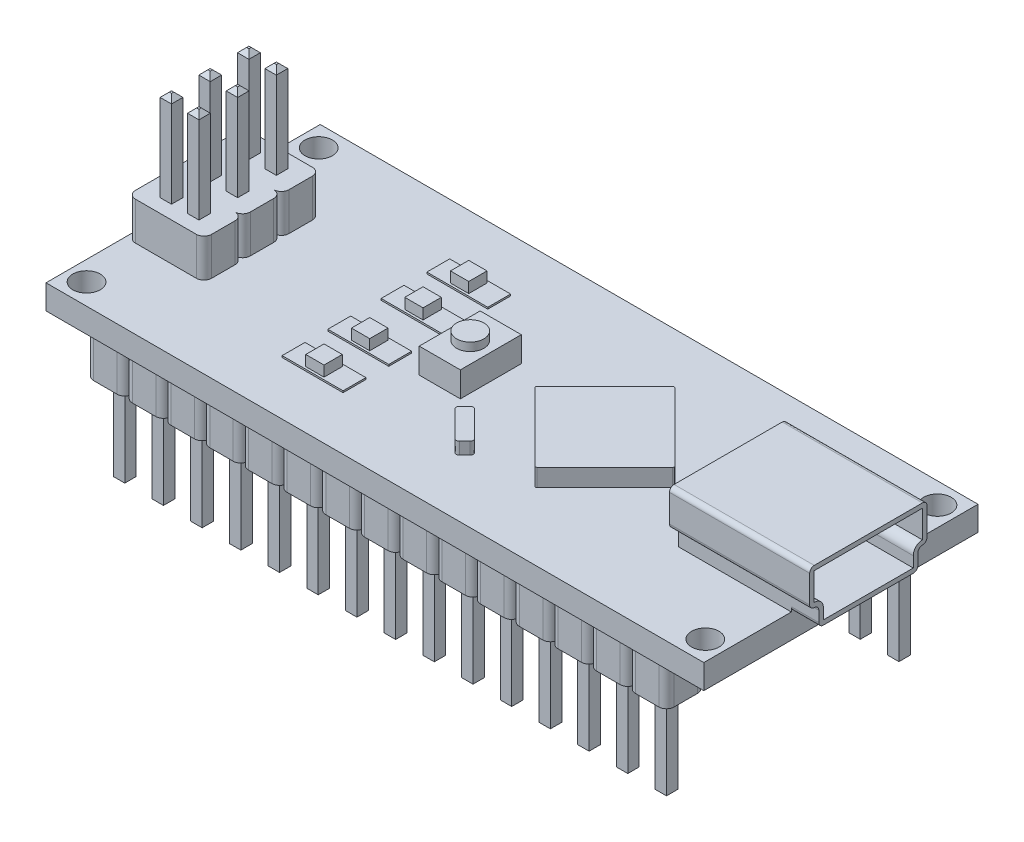
from build123d import *

# Parameters (mm, degrees)
SKETCH1_W                  = 43.18
SKETCH1_H                  = 18
BOSS_EXTRUDE1_DEPTH        = 1.6
SKETCH2_R                  = 0.9
CUT_EXTRUDE1_DEPTH         = 24.445428126
SKETCH3_W                  = 5
SKETCH3_H                  = 2.54
BOSS_EXTRUDE2_DEPTH        = 2.5
FILLET1_R                  = 0.5
SKETCH4_W                  = 0.75
SKETCH4_H                  = 0.75
BOSS_EXTRUDE3_DEPTH        = 6
CHAMFER1_SIZE              = 0.3
MIRROR1_START              = 1.6
MIRROR1_DEPTH              = 2.5
MIRROR1_START_2            = 4.1
MIRROR1_2_OUTLINE_W        = 0.75
MIRROR1_2_OUTLINE_H        = 0.75
MIRROR1_2_DEPTH            = 5.7
MIRROR2_START              = 1.6
MIRROR2_DEPTH              = 2.5
MIRROR2_START_2            = 4.1
MIRROR2_2_OUTLINE_W        = 0.75
MIRROR2_2_OUTLINE_H        = 0.75
MIRROR2_2_DEPTH            = 5.7
SKETCH5_W                  = 4
SKETCH5_H                  = 1.5
SKETCH5_W_2                = 1.2
SKETCH5_H_2                = 1.2
BOSS_EXTRUDE4_DEPTH        = 0.11
SKETCH5_4_W                = 1.2
SKETCH5_4_H                = 1.2
BOSS_EXTRUDE6_DEPTH        = 0.8
SKETCH8_W                  = 2.7
SKETCH8_H                  = 4
BOSS_EXTRUDE7_DEPTH        = 1.65
SKETCH9_R                  = 0.9
BOSS_EXTRUDE8_DEPTH        = 0.54
BOSS_EXTRUDE9_DEPTH        = 1.8
BOSS_EXTRUDE9_DEPTH_BACK   = 7.4
SKETCH10_W                 = 6.5
SKETCH10_H                 = 1.3
FILLET3_R                  = 0.3
CUT_EXTRUDE2_DEPTH         = 5.5
BOSS_EXTRUDE10_DEPTH       = 1.15
FILLET4_R                  = 0.1
BOSS_EXTRUDE11_DEPTH       = 0.8
FILLET5_R                  = 0.2
SKETCH14_W                 = 2.54
SKETCH14_H                 = 2.54
BOSS_EXTRUDE12_DEPTH       = 2.5
FILLET6_R                  = 0.5
LPATTERN1_START            = -2.5
LPATTERN1_DEPTH            = 2.5
SKETCH15_W                 = 2.54
SKETCH15_H                 = 2.54
BOSS_EXTRUDE13_DEPTH       = 2.5
FILLET7_R                  = 0.5
LPATTERN2_START            = -2.5
LPATTERN2_DEPTH            = 2.5
SKETCH16_W                 = 0.75
SKETCH16_H                 = 0.75
BOSS_EXTRUDE14_DEPTH       = 6
CHAMFER2_SIZE              = 0.3
LPATTERN4_COUNT            = 15
LPATTERN4_PITCH            = 2.54
CHAMFER2_OF_LPATTERN4_SIZE = 0.3
MIRROR6_START              = 7.255
MIRROR6_DEPTH              = 0.75
MIRROR6_START_2            = -11.458665389
MIRROR6_2_OUTLINE_W        = 40
MIRROR6_2_OUTLINE_H        = 1.331784092
MIRROR6_2_DEPTH            = 1.458665389
MIRROR6_START_3            = -11.670797423
MIRROR6_3_OUTLINE_W        = 40
MIRROR6_3_OUTLINE_H        = 1.668215908
MIRROR6_3_DEPTH            = 0.212132034


with BuildPart() as part:
    # Sketch1 → Boss-Extrude1 (new body)
    with BuildSketch(Plane(origin=(0, 0, 0), x_dir=(1, 0, 0), z_dir=(0, 1, 0))):
        Rectangle(SKETCH1_W, SKETCH1_H)
    extrude(amount=BOSS_EXTRUDE1_DEPTH)

    # Sketch2 → Cut-Extrude1 (cut, through all)
    with BuildSketch(Plane(origin=(0, 1.6, 0), x_dir=(1, 0, 0), z_dir=(0, 1, 0))):
        with Locations(Location((20.31, 7.62, 0), (0, 0, 270))):
            Circle(SKETCH2_R)
        with Locations(Location((20.31, -7.62, 0), (0, 0, 270))):
            Circle(SKETCH2_R)
        with Locations(Location((-20.31, -7.62, 0), (0, 0, 270))):
            Circle(SKETCH2_R)
        with Locations(Location((-20.31, 7.62, 0), (0, 0, 270))):
            Circle(SKETCH2_R)
    extrude(amount=-CUT_EXTRUDE1_DEPTH, mode=Mode.SUBTRACT)

    # Sketch3 → Boss-Extrude2 (add)
    with BuildSketch(Plane(origin=(0, 1.6, 0), x_dir=(1, 0, 0), z_dir=(0, 1, 0))):
        with Locations((-18.91, 0)):
            Rectangle(SKETCH3_W, SKETCH3_H)
    extrude(amount=BOSS_EXTRUDE2_DEPTH)

    # Fillet1
    fillet1_edges = [part.edges().sort_by_distance(p)[0] for p in [
        (-21.41, 2.85, -1.27),
        (-21.41, 2.85, 1.27),
        (-16.41, 2.85, 1.27),
        (-16.41, 2.85, -1.27),
    ]]
    fillet(fillet1_edges, radius=FILLET1_R)

    # Sketch4 → Boss-Extrude3 (add)
    with BuildSketch(Plane(origin=(0, 4.1, 0), x_dir=(1, 0, 0), z_dir=(0, 1, 0))):
        with Locations((-18.01, 0)):
            Rectangle(SKETCH4_W, SKETCH4_H)
        with Locations((-19.81, 0)):
            Rectangle(SKETCH4_W, SKETCH4_H)
    extrude(amount=BOSS_EXTRUDE3_DEPTH)

    # Chamfer1
    chamfer1_edges = [part.edges().sort_by_distance(p)[0] for p in [
        (-17.635, 10.1, 0),
        (-18.01, 10.1, -0.375),
        (-18.385, 10.1, 0),
        (-18.01, 10.1, 0.375),
        (-20.185, 10.1, 0),
        (-19.81, 10.1, 0.375),
        (-19.435, 10.1, 0),
        (-19.81, 10.1, -0.375),
    ]]
    chamfer(chamfer1_edges, length=CHAMFER1_SIZE)

    # Mirror1: read off the stored shape, not the designer's step
    # Mirror1 outline → Mirror1 (add)
    with BuildSketch(Plane(origin=(0, 0, 0), x_dir=(1, 0, 0), z_dir=(0, 1, 0)).offset(MIRROR1_START)):
        with BuildLine():
            ThreePointArc((-20.91, 3.81), (-21.263553391, 3.663553391), (-21.41, 3.31))
            Line((-21.41, 3.31), (-21.41, 1.77))
            ThreePointArc((-21.41, 1.77), (-21.263553391, 1.416446609), (-20.91, 1.27))
            Line((-20.91, 1.27), (-16.91, 1.27))
            ThreePointArc((-16.91, 1.27), (-16.556446609, 1.416446609), (-16.41, 1.77))
            Line((-16.41, 1.77), (-16.41, 3.31))
            ThreePointArc((-16.41, 3.31), (-16.556446609, 3.663553391), (-16.91, 3.81))
            Line((-16.91, 3.81), (-20.91, 3.81))
        make_face()
    extrude(amount=MIRROR1_DEPTH)

    # Mirror1 2 outline → Mirror1 2 (add)
    with BuildSketch(Plane(origin=(0, 0, 0), x_dir=(1, 0, 0), z_dir=(0, 1, 0)).offset(MIRROR1_START_2)):
        with Locations((-18.01, 2.54)):
            Rectangle(MIRROR1_2_OUTLINE_W, MIRROR1_2_OUTLINE_H)
        with Locations((-19.81, 2.54)):
            Rectangle(MIRROR1_2_OUTLINE_W, MIRROR1_2_OUTLINE_H)
    extrude(amount=MIRROR1_2_DEPTH)

    # Mirror1 3: loft between two sections, ruled curve by curve
    mirror1_3_from = [
        Edge.make_line((-17.635, 9.8, -2.915), (-17.635, 9.8, -2.165)),
        Edge.make_line((-18.385, 9.8, -2.165), (-18.385, 9.8, -2.915)),
        Edge.make_line((-17.635, 9.8, -2.165), (-18.385, 9.8, -2.165)),
        Edge.make_line((-17.635, 9.8, -2.915), (-18.385, 9.8, -2.915)),
    ]
    mirror1_3_to = [
        Edge.make_line((-17.935, 10.1, -2.615), (-17.935, 10.1, -2.465)),
        Edge.make_line((-18.085, 10.1, -2.465), (-18.085, 10.1, -2.615)),
        Edge.make_line((-17.935, 10.1, -2.465), (-18.085, 10.1, -2.465)),
        Edge.make_line((-17.935, 10.1, -2.615), (-18.085, 10.1, -2.615)),
    ]
    mirror1_3 = Solid(Shell([*[Face.make_surface_from_curves(mirror1_3_from[k], mirror1_3_to[k]) for k in range(4)], Face(Wire(mirror1_3_from)), Face(Wire(mirror1_3_to))]))
    add(mirror1_3)

    # Mirror1 4: loft between two sections, ruled curve by curve
    mirror1_4_from = [
        Edge.make_line((-19.435, 9.8, -2.915), (-19.435, 9.8, -2.165)),
        Edge.make_line((-20.185, 9.8, -2.165), (-20.185, 9.8, -2.915)),
        Edge.make_line((-19.435, 9.8, -2.165), (-20.185, 9.8, -2.165)),
        Edge.make_line((-19.435, 9.8, -2.915), (-20.185, 9.8, -2.915)),
    ]
    mirror1_4_to = [
        Edge.make_line((-19.735, 10.1, -2.615), (-19.735, 10.1, -2.465)),
        Edge.make_line((-19.885, 10.1, -2.465), (-19.885, 10.1, -2.615)),
        Edge.make_line((-19.735, 10.1, -2.465), (-19.885, 10.1, -2.465)),
        Edge.make_line((-19.735, 10.1, -2.615), (-19.885, 10.1, -2.615)),
    ]
    mirror1_4 = Solid(Shell([*[Face.make_surface_from_curves(mirror1_4_from[k], mirror1_4_to[k]) for k in range(4)], Face(Wire(mirror1_4_from)), Face(Wire(mirror1_4_to))]))
    add(mirror1_4)

    # Mirror2: read off the stored shape, not the designer's step
    # Mirror2 outline → Mirror2 (add)
    with BuildSketch(Plane(origin=(0, 0, 0), x_dir=(1, 0, 0), z_dir=(0, 1, 0)).offset(MIRROR2_START)):
        with BuildLine():
            ThreePointArc((-20.91, -1.27), (-21.263553391, -1.416446609), (-21.41, -1.77))
            Line((-21.41, -1.77), (-21.41, -3.31))
            ThreePointArc((-21.41, -3.31), (-21.263553391, -3.663553391), (-20.91, -3.81))
            Line((-20.91, -3.81), (-16.91, -3.81))
            ThreePointArc((-16.91, -3.81), (-16.556446609, -3.663553391), (-16.41, -3.31))
            Line((-16.41, -3.31), (-16.41, -1.77))
            ThreePointArc((-16.41, -1.77), (-16.556446609, -1.416446609), (-16.91, -1.27))
            Line((-16.91, -1.27), (-20.91, -1.27))
        make_face()
    extrude(amount=MIRROR2_DEPTH)

    # Mirror2 2 outline → Mirror2 2 (add)
    with BuildSketch(Plane(origin=(0, 0, 0), x_dir=(1, 0, 0), z_dir=(0, 1, 0)).offset(MIRROR2_START_2)):
        with Locations((-18.01, -2.54)):
            Rectangle(MIRROR2_2_OUTLINE_W, MIRROR2_2_OUTLINE_H)
        with Locations((-19.81, -2.54)):
            Rectangle(MIRROR2_2_OUTLINE_W, MIRROR2_2_OUTLINE_H)
    extrude(amount=MIRROR2_2_DEPTH)

    # Mirror2 3: loft between two sections, ruled curve by curve
    mirror2_3_from = [
        Edge.make_line((-17.635, 9.8, 2.165), (-17.635, 9.8, 2.915)),
        Edge.make_line((-18.385, 9.8, 2.915), (-18.385, 9.8, 2.165)),
        Edge.make_line((-17.635, 9.8, 2.915), (-18.385, 9.8, 2.915)),
        Edge.make_line((-17.635, 9.8, 2.165), (-18.385, 9.8, 2.165)),
    ]
    mirror2_3_to = [
        Edge.make_line((-17.935, 10.1, 2.465), (-17.935, 10.1, 2.615)),
        Edge.make_line((-18.085, 10.1, 2.615), (-18.085, 10.1, 2.465)),
        Edge.make_line((-17.935, 10.1, 2.615), (-18.085, 10.1, 2.615)),
        Edge.make_line((-17.935, 10.1, 2.465), (-18.085, 10.1, 2.465)),
    ]
    mirror2_3 = Solid(Shell([*[Face.make_surface_from_curves(mirror2_3_from[k], mirror2_3_to[k]) for k in range(4)], Face(Wire(mirror2_3_from)), Face(Wire(mirror2_3_to))]))
    add(mirror2_3)

    # Mirror2 4: loft between two sections, ruled curve by curve
    mirror2_4_from = [
        Edge.make_line((-19.435, 9.8, 2.165), (-19.435, 9.8, 2.915)),
        Edge.make_line((-20.185, 9.8, 2.915), (-20.185, 9.8, 2.165)),
        Edge.make_line((-19.435, 9.8, 2.915), (-20.185, 9.8, 2.915)),
        Edge.make_line((-19.435, 9.8, 2.165), (-20.185, 9.8, 2.165)),
    ]
    mirror2_4_to = [
        Edge.make_line((-19.735, 10.1, 2.465), (-19.735, 10.1, 2.615)),
        Edge.make_line((-19.885, 10.1, 2.615), (-19.885, 10.1, 2.465)),
        Edge.make_line((-19.735, 10.1, 2.615), (-19.885, 10.1, 2.615)),
        Edge.make_line((-19.735, 10.1, 2.465), (-19.885, 10.1, 2.465)),
    ]
    mirror2_4 = Solid(Shell([*[Face.make_surface_from_curves(mirror2_4_from[k], mirror2_4_to[k]) for k in range(4)], Face(Wire(mirror2_4_from)), Face(Wire(mirror2_4_to))]))
    add(mirror2_4)

    # Sketch5 → Boss-Extrude4 (add)
    # profile 1 of 2: a face of its own
    with BuildSketch(Plane(origin=(0, 1.6, 0), x_dir=(1, 0, 0), z_dir=(0, 1, 0))):
        with Locations((-7.59, 4.75)):
            Rectangle(SKETCH5_W, SKETCH5_H)
        with Locations((-7.59, 4.75)):
            Rectangle(SKETCH5_W_2, SKETCH5_H_2, mode=Mode.SUBTRACT)
    # profile 2 of 2: a face of its own
    with BuildSketch(Plane(origin=(0, 1.6, 0), x_dir=(1, 0, 0), z_dir=(0, 1, 0))):
        with Locations((-7.59, 1.75)):
            Rectangle(SKETCH5_W, SKETCH5_H)
        with Locations((-7.59, 1.75)):
            Rectangle(SKETCH5_W_2, SKETCH5_H_2, mode=Mode.SUBTRACT)
    boss_extrude4 = extrude(amount=BOSS_EXTRUDE4_DEPTH)

    # Sketch5<4> → Boss-Extrude6 (add)
    with BuildSketch(Plane(origin=(0, 1.6, 0), x_dir=(1, 0, 0), z_dir=(0, 1, 0))):
        with Locations((-7.59, 4.75)):
            Rectangle(SKETCH5_4_W, SKETCH5_4_H)
        with Locations((-7.59, 1.75)):
            Rectangle(SKETCH5_4_W, SKETCH5_4_H)
    boss_extrude6 = extrude(amount=BOSS_EXTRUDE6_DEPTH)

    # Mirror3: Boss-Extrude4, Boss-Extrude6 across plane
    add(boss_extrude4.mirror(Plane.XY))
    add(boss_extrude6.mirror(Plane.XY))

    # Sketch8 → Boss-Extrude7 (add)
    with BuildSketch(Plane(origin=(0, 1.6, 0), x_dir=(1, 0, 0), z_dir=(0, 1, 0))):
        with Locations((-2.74, 0)):
            Rectangle(SKETCH8_W, SKETCH8_H)
    extrude(amount=BOSS_EXTRUDE7_DEPTH)

    # Sketch9 → Boss-Extrude8 (add)
    with BuildSketch(Plane(origin=(0, 3.25, 0), x_dir=(1, 0, 0), z_dir=(0, 1, 0))):
        with Locations(Location((-2.74, 0, 0), (0, 0, 270))):
            Circle(SKETCH9_R)
    extrude(amount=BOSS_EXTRUDE8_DEPTH)

    # Sketch10 → Boss-Extrude9 (add, two sides: drawn at the far end of the back side and taken through both)
    with BuildSketch(Plane(origin=(21.59, 0, 0), x_dir=(0, 0, -1), z_dir=(1, 0, 0)).offset(-BOSS_EXTRUDE9_DEPTH_BACK)):
        Polygon((-3.85, 2.9), (-3.25, 2.9), (3.25, 2.9), (3.85, 2.9), (3.85, 5.3), (-3.85, 5.3), align=None)
        with Locations((0, 2.25)):
            Rectangle(SKETCH10_W, SKETCH10_H)
    extrude(amount=BOSS_EXTRUDE9_DEPTH + BOSS_EXTRUDE9_DEPTH_BACK)

    # Fillet3
    fillet3_edges = [part.edges().sort_by_distance(p)[0] for p in [
        (18.79, 2.9, 3.25),
        (18.79, 2.9, 3.85),
        (18.79, 2.9, -3.85),
        (18.79, 2.9, -3.25),
        (22.49, 1.6, 3.25),
        (22.49, 1.6, -3.25),
        (18.79, 5.3, -3.85),
        (18.79, 5.3, 3.85),
    ]]
    fillet(fillet3_edges, radius=FILLET3_R - 0.0001)  # a hair under: the kernel refuses the full size

    # Sketch11 → Cut-Extrude2 (cut)
    with BuildSketch(Plane(origin=(23.39, 0, 0), x_dir=(0, 0, -1), z_dir=(1, 0, 0))):
        with BuildLine():
            ThreePointArc((3.55, 3.2), (3.125735931, 3.024264069), (2.95, 2.6))
            Line((2.95, 2.6), (2.95, 1.9))
            Line((2.95, 1.9), (-2.95, 1.9))
            Line((-2.95, 1.9), (-2.95, 2.6))
            ThreePointArc((-2.95, 2.6), (-3.125735931, 3.024264069), (-3.55, 3.2))
            Line((-3.55, 3.2), (-3.55, 5))
            Line((-3.55, 5), (3.55, 5))
            Line((3.55, 5), (3.55, 3.2))
        make_face()
    extrude(amount=-CUT_EXTRUDE2_DEPTH, mode=Mode.SUBTRACT)

    # Sketch12 → Boss-Extrude10 (add)
    with BuildSketch(Plane(origin=(0, 1.6, 0), x_dir=(1, 0, 0), z_dir=(0, 1, 0))):
        Polygon((1.497611845, 0), (6.093805922, 4.596194078), (10.69, 0), (6.093805922, -4.596194078), align=None)
    extrude(amount=BOSS_EXTRUDE10_DEPTH)

    # Fillet4
    fillet4_edges = [part.edges().sort_by_distance(p)[0] for p in [
        (1.497611845, 2.175, 0),
        (6.093805922, 2.175, 4.596194078),
        (10.69, 2.175, 0),
        (6.093805922, 2.175, -4.596194078),
    ]]
    fillet(fillet4_edges, radius=FILLET4_R)

    # Sketch13 → Boss-Extrude11 (add)
    with BuildSketch(Plane(origin=(0, 1.6, 0), x_dir=(1, 0, 0), z_dir=(0, 1, 0))):
        Polygon((2.275429304, -4.737615434), (0.295530317, -2.757716447), (-0.340865787, -3.39411255), (1.639033201, -5.374011537), align=None)
    extrude(amount=BOSS_EXTRUDE11_DEPTH)

    # Fillet5
    fillet5_edges = [part.edges().sort_by_distance(p)[0] for p in [
        (1.639033201, 2, 5.374011537),
        (2.275429304, 2, 4.737615434),
        (0.295530317, 2, 2.757716447),
        (-0.340865787, 2, 3.39411255),
    ]]
    fillet(fillet5_edges, radius=FILLET5_R)

    # Sketch14 → Boss-Extrude12 (add)
    with BuildSketch(Plane.XZ):
        with Locations((17.77, -7.63)):
            Rectangle(SKETCH14_W, SKETCH14_H)
    extrude(amount=BOSS_EXTRUDE12_DEPTH)

    # Fillet6
    fillet6_edges = [part.edges().sort_by_distance(p)[0] for p in [
        (19.04, -1.25, -8.9),
        (19.04, -1.25, -6.36),
        (16.5, -1.25, -6.36),
        (16.5, -1.25, -8.9),
    ]]
    fillet(fillet6_edges, radius=FILLET6_R)

    # LPattern1: read off the stored shape, not the designer's step
    # LPattern1 outline → LPattern1 (add)
    with BuildSketch(Plane(origin=(0, 0, 0), x_dir=(1, 0, 0), z_dir=(0, 1, 0)).offset(LPATTERN1_START)):
        with BuildLine():
            Line((14.46, 6.36), (16, 6.36))
            ThreePointArc((16, 6.36), (16.353553391, 6.506446609), (16.5, 6.86))
            Line((16.5, 6.86), (16.5, 8.4))
            ThreePointArc((16.5, 8.4), (16.353553391, 8.753553391), (16, 8.9))
            Line((16, 8.9), (14.46, 8.9))
            ThreePointArc((14.46, 8.9), (14.106446609, 8.753553391), (13.96, 8.4))
            ThreePointArc((13.96, 8.4), (13.813553391, 8.753553391), (13.46, 8.9))
            Line((13.46, 8.9), (11.92, 8.9))
            ThreePointArc((11.92, 8.9), (11.566446609, 8.753553391), (11.42, 8.4))
            ThreePointArc((11.42, 8.4), (11.273553391, 8.753553391), (10.92, 8.9))
            Line((10.92, 8.9), (9.38, 8.9))
            ThreePointArc((9.38, 8.9), (9.026446609, 8.753553391), (8.88, 8.4))
            ThreePointArc((8.88, 8.4), (8.733553391, 8.753553391), (8.38, 8.9))
            Line((8.38, 8.9), (6.84, 8.9))
            ThreePointArc((6.84, 8.9), (6.486446609, 8.753553391), (6.34, 8.4))
            ThreePointArc((6.34, 8.4), (6.193553391, 8.753553391), (5.84, 8.9))
            Line((5.84, 8.9), (4.3, 8.9))
            ThreePointArc((4.3, 8.9), (3.946446609, 8.753553391), (3.8, 8.4))
            ThreePointArc((3.8, 8.4), (3.653553391, 8.753553391), (3.3, 8.9))
            Line((3.3, 8.9), (1.76, 8.9))
            ThreePointArc((1.76, 8.9), (1.406446609, 8.753553391), (1.26, 8.4))
            ThreePointArc((1.26, 8.4), (1.113553391, 8.753553391), (0.76, 8.9))
            Line((0.76, 8.9), (-0.78, 8.9))
            ThreePointArc((-0.78, 8.9), (-1.133553391, 8.753553391), (-1.28, 8.4))
            ThreePointArc((-1.28, 8.4), (-1.426446609, 8.753553391), (-1.78, 8.9))
            Line((-1.78, 8.9), (-3.32, 8.9))
            ThreePointArc((-3.32, 8.9), (-3.673553391, 8.753553391), (-3.82, 8.4))
            ThreePointArc((-3.82, 8.4), (-3.966446609, 8.753553391), (-4.32, 8.9))
            Line((-4.32, 8.9), (-5.86, 8.9))
            ThreePointArc((-5.86, 8.9), (-6.213553391, 8.753553391), (-6.36, 8.4))
            ThreePointArc((-6.36, 8.4), (-6.506446609, 8.753553391), (-6.86, 8.9))
            Line((-6.86, 8.9), (-8.4, 8.9))
            ThreePointArc((-8.4, 8.9), (-8.753553391, 8.753553391), (-8.9, 8.4))
            ThreePointArc((-8.9, 8.4), (-9.046446609, 8.753553391), (-9.4, 8.9))
            Line((-9.4, 8.9), (-10.94, 8.9))
            ThreePointArc((-10.94, 8.9), (-11.293553391, 8.753553391), (-11.44, 8.4))
            ThreePointArc((-11.44, 8.4), (-11.586446609, 8.753553391), (-11.94, 8.9))
            Line((-11.94, 8.9), (-13.48, 8.9))
            ThreePointArc((-13.48, 8.9), (-13.833553391, 8.753553391), (-13.98, 8.4))
            ThreePointArc((-13.98, 8.4), (-14.126446609, 8.753553391), (-14.48, 8.9))
            Line((-14.48, 8.9), (-16.02, 8.9))
            ThreePointArc((-16.02, 8.9), (-16.373553391, 8.753553391), (-16.52, 8.4))
            ThreePointArc((-16.52, 8.4), (-16.666446609, 8.753553391), (-17.02, 8.9))
            Line((-17.02, 8.9), (-18.56, 8.9))
            ThreePointArc((-18.56, 8.9), (-18.913553391, 8.753553391), (-19.06, 8.4))
            Line((-19.06, 8.4), (-19.06, 6.86))
            ThreePointArc((-19.06, 6.86), (-18.913553391, 6.506446609), (-18.56, 6.36))
            Line((-18.56, 6.36), (-17.02, 6.36))
            ThreePointArc((-17.02, 6.36), (-16.666446609, 6.506446609), (-16.52, 6.86))
            ThreePointArc((-16.52, 6.86), (-16.373553391, 6.506446609), (-16.02, 6.36))
            Line((-16.02, 6.36), (-14.48, 6.36))
            ThreePointArc((-14.48, 6.36), (-14.126446609, 6.506446609), (-13.98, 6.86))
            ThreePointArc((-13.98, 6.86), (-13.833553391, 6.506446609), (-13.48, 6.36))
            Line((-13.48, 6.36), (-11.94, 6.36))
            ThreePointArc((-11.94, 6.36), (-11.586446609, 6.506446609), (-11.44, 6.86))
            ThreePointArc((-11.44, 6.86), (-11.293553391, 6.506446609), (-10.94, 6.36))
            Line((-10.94, 6.36), (-9.4, 6.36))
            ThreePointArc((-9.4, 6.36), (-9.046446609, 6.506446609), (-8.9, 6.86))
            ThreePointArc((-8.9, 6.86), (-8.753553391, 6.506446609), (-8.4, 6.36))
            Line((-8.4, 6.36), (-6.86, 6.36))
            ThreePointArc((-6.86, 6.36), (-6.506446609, 6.506446609), (-6.36, 6.86))
            ThreePointArc((-6.36, 6.86), (-6.213553391, 6.506446609), (-5.86, 6.36))
            Line((-5.86, 6.36), (-4.32, 6.36))
            ThreePointArc((-4.32, 6.36), (-3.966446609, 6.506446609), (-3.82, 6.86))
            ThreePointArc((-3.82, 6.86), (-3.673553391, 6.506446609), (-3.32, 6.36))
            Line((-3.32, 6.36), (-1.78, 6.36))
            ThreePointArc((-1.78, 6.36), (-1.426446609, 6.506446609), (-1.28, 6.86))
            ThreePointArc((-1.28, 6.86), (-1.133553391, 6.506446609), (-0.78, 6.36))
            Line((-0.78, 6.36), (0.76, 6.36))
            ThreePointArc((0.76, 6.36), (1.113553391, 6.506446609), (1.26, 6.86))
            ThreePointArc((1.26, 6.86), (1.406446609, 6.506446609), (1.76, 6.36))
            Line((1.76, 6.36), (3.3, 6.36))
            ThreePointArc((3.3, 6.36), (3.653553391, 6.506446609), (3.8, 6.86))
            ThreePointArc((3.8, 6.86), (3.946446609, 6.506446609), (4.3, 6.36))
            Line((4.3, 6.36), (5.84, 6.36))
            ThreePointArc((5.84, 6.36), (6.193553391, 6.506446609), (6.34, 6.86))
            ThreePointArc((6.34, 6.86), (6.486446609, 6.506446609), (6.84, 6.36))
            Line((6.84, 6.36), (8.38, 6.36))
            ThreePointArc((8.38, 6.36), (8.733553391, 6.506446609), (8.88, 6.86))
            ThreePointArc((8.88, 6.86), (9.026446609, 6.506446609), (9.38, 6.36))
            Line((9.38, 6.36), (10.92, 6.36))
            ThreePointArc((10.92, 6.36), (11.273553391, 6.506446609), (11.42, 6.86))
            ThreePointArc((11.42, 6.86), (11.566446609, 6.506446609), (11.92, 6.36))
            Line((11.92, 6.36), (13.46, 6.36))
            ThreePointArc((13.46, 6.36), (13.813553391, 6.506446609), (13.96, 6.86))
            ThreePointArc((13.96, 6.86), (14.106446609, 6.506446609), (14.46, 6.36))
        make_face()
    extrude(amount=LPATTERN1_DEPTH)

    # Sketch15 → Boss-Extrude13 (add)
    with BuildSketch(Plane(origin=(0, 0, 0), x_dir=(-1, 0, 0), z_dir=(0, -1, 0))):
        with Locations((-17.77, -7.63)):
            Rectangle(SKETCH15_W, SKETCH15_H)
    extrude(amount=BOSS_EXTRUDE13_DEPTH)

    # Fillet7
    fillet7_edges = [part.edges().sort_by_distance(p)[0] for p in [
        (19.04, -1.25, 6.36),
        (19.04, -1.25, 8.9),
        (16.5, -1.25, 8.9),
        (16.5, -1.25, 6.36),
    ]]
    fillet(fillet7_edges, radius=FILLET7_R)

    # LPattern2: read off the stored shape, not the designer's step
    # LPattern2 outline → LPattern2 (add)
    with BuildSketch(Plane(origin=(0, 0, 0), x_dir=(1, 0, 0), z_dir=(0, 1, 0)).offset(LPATTERN2_START)):
        with BuildLine():
            Line((-19.06, -6.86), (-19.06, -8.4))
            ThreePointArc((-19.06, -8.4), (-18.913553391, -8.753553391), (-18.56, -8.9))
            Line((-18.56, -8.9), (-17.02, -8.9))
            ThreePointArc((-17.02, -8.9), (-16.666446609, -8.753553391), (-16.52, -8.4))
            ThreePointArc((-16.52, -8.4), (-16.373553391, -8.753553391), (-16.02, -8.9))
            Line((-16.02, -8.9), (-14.48, -8.9))
            ThreePointArc((-14.48, -8.9), (-14.126446609, -8.753553391), (-13.98, -8.4))
            ThreePointArc((-13.98, -8.4), (-13.833553391, -8.753553391), (-13.48, -8.9))
            Line((-13.48, -8.9), (-11.94, -8.9))
            ThreePointArc((-11.94, -8.9), (-11.586446609, -8.753553391), (-11.44, -8.4))
            ThreePointArc((-11.44, -8.4), (-11.293553391, -8.753553391), (-10.94, -8.9))
            Line((-10.94, -8.9), (-9.4, -8.9))
            ThreePointArc((-9.4, -8.9), (-9.046446609, -8.753553391), (-8.9, -8.4))
            ThreePointArc((-8.9, -8.4), (-8.753553391, -8.753553391), (-8.4, -8.9))
            Line((-8.4, -8.9), (-6.86, -8.9))
            ThreePointArc((-6.86, -8.9), (-6.506446609, -8.753553391), (-6.36, -8.4))
            ThreePointArc((-6.36, -8.4), (-6.213553391, -8.753553391), (-5.86, -8.9))
            Line((-5.86, -8.9), (-4.32, -8.9))
            ThreePointArc((-4.32, -8.9), (-3.966446609, -8.753553391), (-3.82, -8.4))
            ThreePointArc((-3.82, -8.4), (-3.673553391, -8.753553391), (-3.32, -8.9))
            Line((-3.32, -8.9), (-1.78, -8.9))
            ThreePointArc((-1.78, -8.9), (-1.426446609, -8.753553391), (-1.28, -8.4))
            ThreePointArc((-1.28, -8.4), (-1.133553391, -8.753553391), (-0.78, -8.9))
            Line((-0.78, -8.9), (0.76, -8.9))
            ThreePointArc((0.76, -8.9), (1.113553391, -8.753553391), (1.26, -8.4))
            ThreePointArc((1.26, -8.4), (1.406446609, -8.753553391), (1.76, -8.9))
            Line((1.76, -8.9), (3.3, -8.9))
            ThreePointArc((3.3, -8.9), (3.653553391, -8.753553391), (3.8, -8.4))
            ThreePointArc((3.8, -8.4), (3.946446609, -8.753553391), (4.3, -8.9))
            Line((4.3, -8.9), (5.84, -8.9))
            ThreePointArc((5.84, -8.9), (6.193553391, -8.753553391), (6.34, -8.4))
            ThreePointArc((6.34, -8.4), (6.486446609, -8.753553391), (6.84, -8.9))
            Line((6.84, -8.9), (8.38, -8.9))
            ThreePointArc((8.38, -8.9), (8.733553391, -8.753553391), (8.88, -8.4))
            ThreePointArc((8.88, -8.4), (9.026446609, -8.753553391), (9.38, -8.9))
            Line((9.38, -8.9), (10.92, -8.9))
            ThreePointArc((10.92, -8.9), (11.273553391, -8.753553391), (11.42, -8.4))
            ThreePointArc((11.42, -8.4), (11.566446609, -8.753553391), (11.92, -8.9))
            Line((11.92, -8.9), (13.46, -8.9))
            ThreePointArc((13.46, -8.9), (13.813553391, -8.753553391), (13.96, -8.4))
            ThreePointArc((13.96, -8.4), (14.106446609, -8.753553391), (14.46, -8.9))
            Line((14.46, -8.9), (16, -8.9))
            ThreePointArc((16, -8.9), (16.353553391, -8.753553391), (16.5, -8.4))
            Line((16.5, -8.4), (16.5, -6.86))
            ThreePointArc((16.5, -6.86), (16.353553391, -6.506446609), (16, -6.36))
            Line((16, -6.36), (14.46, -6.36))
            ThreePointArc((14.46, -6.36), (14.106446609, -6.506446609), (13.96, -6.86))
            ThreePointArc((13.96, -6.86), (13.813553391, -6.506446609), (13.46, -6.36))
            Line((13.46, -6.36), (11.92, -6.36))
            ThreePointArc((11.92, -6.36), (11.566446609, -6.506446609), (11.42, -6.86))
            ThreePointArc((11.42, -6.86), (11.273553391, -6.506446609), (10.92, -6.36))
            Line((10.92, -6.36), (9.38, -6.36))
            ThreePointArc((9.38, -6.36), (9.026446609, -6.506446609), (8.88, -6.86))
            ThreePointArc((8.88, -6.86), (8.733553391, -6.506446609), (8.38, -6.36))
            Line((8.38, -6.36), (6.84, -6.36))
            ThreePointArc((6.84, -6.36), (6.486446609, -6.506446609), (6.34, -6.86))
            ThreePointArc((6.34, -6.86), (6.193553391, -6.506446609), (5.84, -6.36))
            Line((5.84, -6.36), (4.3, -6.36))
            ThreePointArc((4.3, -6.36), (3.946446609, -6.506446609), (3.8, -6.86))
            ThreePointArc((3.8, -6.86), (3.653553391, -6.506446609), (3.3, -6.36))
            Line((3.3, -6.36), (1.76, -6.36))
            ThreePointArc((1.76, -6.36), (1.406446609, -6.506446609), (1.26, -6.86))
            ThreePointArc((1.26, -6.86), (1.113553391, -6.506446609), (0.76, -6.36))
            Line((0.76, -6.36), (-0.78, -6.36))
            ThreePointArc((-0.78, -6.36), (-1.133553391, -6.506446609), (-1.28, -6.86))
            ThreePointArc((-1.28, -6.86), (-1.426446609, -6.506446609), (-1.78, -6.36))
            Line((-1.78, -6.36), (-3.32, -6.36))
            ThreePointArc((-3.32, -6.36), (-3.673553391, -6.506446609), (-3.82, -6.86))
            ThreePointArc((-3.82, -6.86), (-3.966446609, -6.506446609), (-4.32, -6.36))
            Line((-4.32, -6.36), (-5.86, -6.36))
            ThreePointArc((-5.86, -6.36), (-6.213553391, -6.506446609), (-6.36, -6.86))
            ThreePointArc((-6.36, -6.86), (-6.506446609, -6.506446609), (-6.86, -6.36))
            Line((-6.86, -6.36), (-8.4, -6.36))
            ThreePointArc((-8.4, -6.36), (-8.753553391, -6.506446609), (-8.9, -6.86))
            ThreePointArc((-8.9, -6.86), (-9.046446609, -6.506446609), (-9.4, -6.36))
            Line((-9.4, -6.36), (-10.94, -6.36))
            ThreePointArc((-10.94, -6.36), (-11.293553391, -6.506446609), (-11.44, -6.86))
            ThreePointArc((-11.44, -6.86), (-11.586446609, -6.506446609), (-11.94, -6.36))
            Line((-11.94, -6.36), (-13.48, -6.36))
            ThreePointArc((-13.48, -6.36), (-13.833553391, -6.506446609), (-13.98, -6.86))
            ThreePointArc((-13.98, -6.86), (-14.126446609, -6.506446609), (-14.48, -6.36))
            Line((-14.48, -6.36), (-16.02, -6.36))
            ThreePointArc((-16.02, -6.36), (-16.373553391, -6.506446609), (-16.52, -6.86))
            ThreePointArc((-16.52, -6.86), (-16.666446609, -6.506446609), (-17.02, -6.36))
            Line((-17.02, -6.36), (-18.56, -6.36))
            ThreePointArc((-18.56, -6.36), (-18.913553391, -6.506446609), (-19.06, -6.86))
        make_face()
    extrude(amount=LPATTERN2_DEPTH)

    # Sketch16 → Boss-Extrude14 (add)
    with BuildSketch(Plane.XZ.offset(2.5)):
        with Locations((17.77, -7.63)):
            Rectangle(SKETCH16_W, SKETCH16_H)
    boss_extrude14 = extrude(amount=BOSS_EXTRUDE14_DEPTH)

    # Chamfer2
    chamfer2_edges = [part.edges().sort_by_distance(p)[0] for p in [
        (18.145, -8.5, -7.63),
        (17.77, -8.5, -7.255),
        (17.395, -8.5, -7.63),
        (17.77, -8.5, -8.005),
    ]]
    chamfer(chamfer2_edges, length=CHAMFER2_SIZE)

    # LPattern4: Boss-Extrude14 ×15
    with Locations(*[(-i * LPATTERN4_PITCH, 0, 0) for i in range(1, LPATTERN4_COUNT)]):
        add(boss_extrude14)

    # Chamfer2 of LPattern4
    chamfer2_of_lpattern4_edges = [part.edges().sort_by_distance(p)[0] for p in [
        (15.605, -8.5, -7.63),
        (15.23, -8.5, -7.255),
        (14.855, -8.5, -7.63),
        (15.23, -8.5, -8.005),
        (13.065, -8.5, -7.63),
        (12.69, -8.5, -7.255),
        (12.315, -8.5, -7.63),
        (12.69, -8.5, -8.005),
        (10.525, -8.5, -7.63),
        (10.15, -8.5, -7.255),
        (9.775, -8.5, -7.63),
        (10.15, -8.5, -8.005),
        (7.985, -8.5, -7.63),
        (7.61, -8.5, -7.255),
        (7.235, -8.5, -7.63),
        (7.61, -8.5, -8.005),
        (5.445, -8.5, -7.63),
        (5.07, -8.5, -7.255),
        (4.695, -8.5, -7.63),
        (5.07, -8.5, -8.005),
        (2.905, -8.5, -7.63),
        (2.53, -8.5, -7.255),
        (2.155, -8.5, -7.63),
        (2.53, -8.5, -8.005),
        (0.365, -8.5, -7.63),
        (-0.01, -8.5, -7.255),
        (-0.385, -8.5, -7.63),
        (-0.01, -8.5, -8.005),
        (-2.175, -8.5, -7.63),
        (-2.55, -8.5, -7.255),
        (-2.925, -8.5, -7.63),
        (-2.55, -8.5, -8.005),
        (-4.715, -8.5, -7.63),
        (-5.09, -8.5, -7.255),
        (-5.465, -8.5, -7.63),
        (-5.09, -8.5, -8.005),
        (-7.255, -8.5, -7.63),
        (-7.63, -8.5, -7.255),
        (-8.005, -8.5, -7.63),
        (-7.63, -8.5, -8.005),
        (-9.795, -8.5, -7.63),
        (-10.17, -8.5, -7.255),
        (-10.545, -8.5, -7.63),
        (-10.17, -8.5, -8.005),
        (-12.335, -8.5, -7.63),
        (-12.71, -8.5, -7.255),
        (-13.085, -8.5, -7.63),
        (-12.71, -8.5, -8.005),
        (-14.875, -8.5, -7.63),
        (-15.25, -8.5, -7.255),
        (-15.625, -8.5, -7.63),
        (-15.25, -8.5, -8.005),
        (-17.415, -8.5, -7.63),
        (-17.79, -8.5, -7.255),
        (-18.165, -8.5, -7.63),
        (-17.79, -8.5, -8.005),
    ]]
    chamfer(chamfer2_of_lpattern4_edges, length=CHAMFER2_OF_LPATTERN4_SIZE)

    # Mirror6: read off the stored shape, not the designer's step
    # Mirror6 outline → Mirror6 (add)
    with BuildSketch(Plane.XY.offset(MIRROR6_START)):
        Polygon((18.145, -2.5), (17.395, -2.5), (17.395, -8.2), (17.695, -8.5), (17.845, -8.5), (18.145, -8.2), align=None)
        Polygon((15.605, -2.5), (14.855, -2.5), (14.855, -8.2), (15.155, -8.5), (15.305, -8.5), (15.605, -8.2), align=None)
        Polygon((13.065, -2.5), (12.315, -2.5), (12.315, -8.2), (12.615, -8.5), (12.765, -8.5), (13.065, -8.2), align=None)
        Polygon((10.525, -2.5), (9.775, -2.5), (9.775, -8.2), (10.075, -8.5), (10.225, -8.5), (10.525, -8.2), align=None)
        Polygon((7.985, -2.5), (7.235, -2.5), (7.235, -8.2), (7.535, -8.5), (7.685, -8.5), (7.985, -8.2), align=None)
        Polygon((5.445, -2.5), (4.695, -2.5), (4.695, -8.2), (4.995, -8.5), (5.145, -8.5), (5.445, -8.2), align=None)
        Polygon((2.905, -2.5), (2.155, -2.5), (2.155, -8.2), (2.455, -8.5), (2.605, -8.5), (2.905, -8.2), align=None)
        Polygon((0.365, -2.5), (-0.385, -2.5), (-0.385, -8.2), (-0.085, -8.5), (0.065, -8.5), (0.365, -8.2), align=None)
        Polygon((-2.175, -2.5), (-2.925, -2.5), (-2.925, -8.2), (-2.625, -8.5), (-2.475, -8.5), (-2.175, -8.2), align=None)
        Polygon((-4.715, -2.5), (-5.465, -2.5), (-5.465, -8.2), (-5.165, -8.5), (-5.015, -8.5), (-4.715, -8.2), align=None)
        Polygon((-7.255, -2.5), (-8.005, -2.5), (-8.005, -8.2), (-7.705, -8.5), (-7.555, -8.5), (-7.255, -8.2), align=None)
        Polygon((-9.795, -2.5), (-10.545, -2.5), (-10.545, -8.2), (-10.245, -8.5), (-10.095, -8.5), (-9.795, -8.2), align=None)
        Polygon((-12.335, -2.5), (-13.085, -2.5), (-13.085, -8.2), (-12.785, -8.5), (-12.635, -8.5), (-12.335, -8.2), align=None)
        Polygon((-14.875, -2.5), (-15.625, -2.5), (-15.625, -8.2), (-15.325, -8.5), (-15.175, -8.5), (-14.875, -8.2), align=None)
        Polygon((-17.715, -8.5), (-17.415, -8.2), (-17.415, -2.5), (-18.165, -2.5), (-18.165, -8.2), (-17.865, -8.5), align=None)
    extrude(amount=MIRROR6_DEPTH)

    # Mirror6 2 outline → Mirror6 2 (cut)
    with BuildSketch(Plane(origin=(0, 0, 0), x_dir=(1, 0, 0), z_dir=(0, 0.7071067811865476, -0.7071067811865476)).offset(MIRROR6_START_2)):
        with Locations((0, 1.334107954)):
            Rectangle(MIRROR6_2_OUTLINE_W, MIRROR6_2_OUTLINE_H)
    extrude(amount=MIRROR6_2_DEPTH, mode=Mode.SUBTRACT)

    # Mirror6 3 outline → Mirror6 3 (cut)
    with BuildSketch(Plane(origin=(0, 0, 0), x_dir=(1, 0, 0), z_dir=(0, 0.7071067811865476, -0.7071067811865476)).offset(MIRROR6_START_3)):
        with Locations((0, -0.165892046)):
            Rectangle(MIRROR6_3_OUTLINE_W, MIRROR6_3_OUTLINE_H)
    extrude(amount=MIRROR6_3_DEPTH, mode=Mode.SUBTRACT)


solid = part.part
